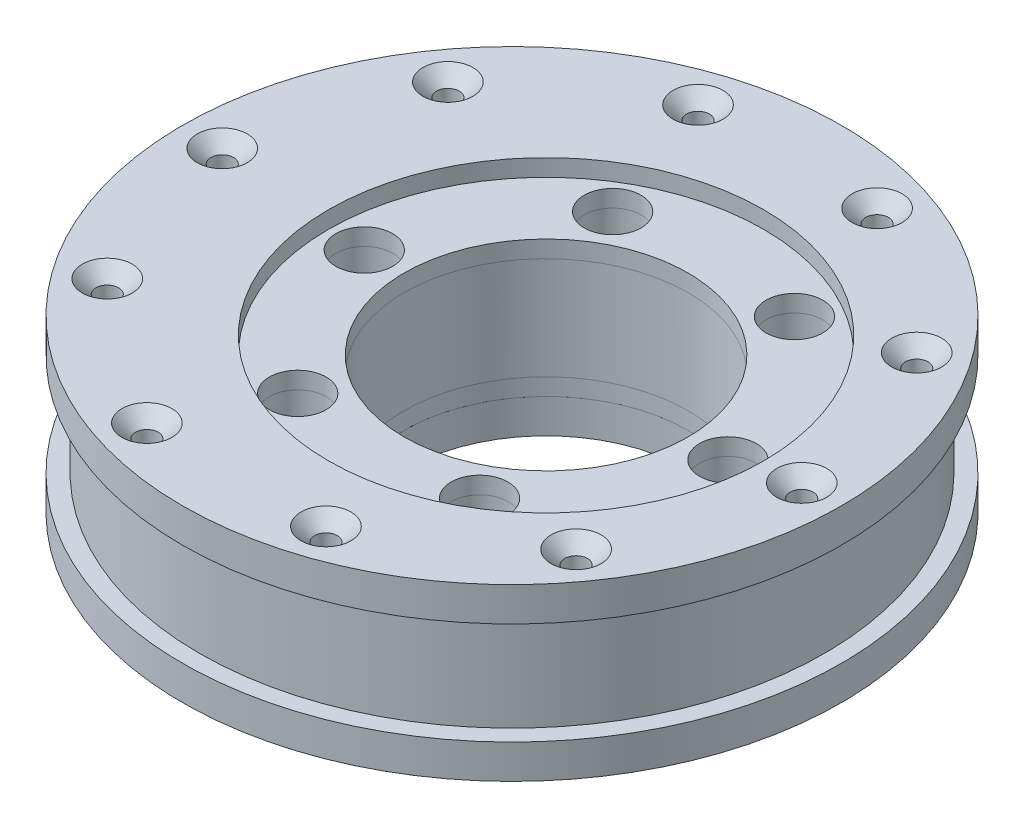
from build123d import *
from build123d.topology import SkipClean

# Parameters (mm, degrees)
SKETCH14_R              = 27.5
SKETCH14_R_2            = 1
SKETCH14_R_3            = 2
BOSS_EXTRUDE7_DEPTH     = 9
BOSS_EXTRUDE8_START     = 3
SKETCH15_R              = 29
SKETCH15_R_2            = 2
SKETCH15_R_3            = 1
BOSS_EXTRUDE8_DEPTH     = 3
SKETCH16_R              = 12.5
CUT_EXTRUDE1_DEPTH      = 16
SKETCH17_R              = 29
SKETCH17_R_2            = 2
SKETCH17_R_3            = 1
SKETCH17_R_4            = 12.5
BOSS_EXTRUDE9_DEPTH     = 3
CHAMFER1_SIZE           = 1.2
CHAMFER2_SIZE           = 1.2
SKETCH18_R              = 19.15
CUT_EXTRUDE2_DEPTH      = 1.5
SKETCH19_R              = 19.15
CUT_EXTRUDE3_DEPTH      = 1.5
SKETCH20_R              = 19.15
SKETCH20_R_2            = 12.5
SKETCH20_R_3            = 2
BOSS_EXTRUDE10_DEPTH    = 3
SKETCH21_R              = 1.75
CUT_EXTRUDE4_DEPTH      = 3
SKETCH22_R              = 1
BOSS_EXTRUDE11_DEPTH    = 3
SKETCH23_R              = 1.75
CUT_EXTRUDE5_DEPTH      = 3
CUT_EXTRUDE6_DEPTH      = 44.669211122
CUT_EXTRUDE6_DEPTH_BACK = 44.669211122
SKETCH24_R              = 2.5


# Read off the part's stored shape, not the designer's step: Intersect1, Intersect2
with BuildPart() as part:
    # Sketch14 → Boss-Extrude7 (new body)
    with BuildSketch(Plane(origin=(0, 0, 0), x_dir=(1, 0, 0), z_dir=(0, 1, 0))):
        with Locations(Location((0, 0, 0), (0, 0, 270))):
            Circle(SKETCH14_R)
        with Locations(Location((-25.5, 0, 0), (0, 0, 270))):
            Circle(SKETCH14_R_2, mode=Mode.SUBTRACT)
        with Locations(Location((-20.629933357, 14.988523933, 0), (0, 0, 270))):
            Circle(SKETCH14_R_2, mode=Mode.SUBTRACT)
        with Locations(Location((-7.879933357, 24.251941166, 0), (0, 0, 270))):
            Circle(SKETCH14_R_2, mode=Mode.SUBTRACT)
        with Locations(Location((7.879933357, 24.251941166, 0), (0, 0, 270))):
            Circle(SKETCH14_R_2, mode=Mode.SUBTRACT)
        with Locations(Location((20.629933357, 14.988523933, 0), (0, 0, 270))):
            Circle(SKETCH14_R_2, mode=Mode.SUBTRACT)
        with Locations(Location((25.5, 0, 0), (0, 0, 270))):
            Circle(SKETCH14_R_2, mode=Mode.SUBTRACT)
        with Locations(Location((20.629933357, -14.988523933, 0), (0, 0, 270))):
            Circle(SKETCH14_R_2, mode=Mode.SUBTRACT)
        with Locations(Location((7.879933357, -24.251941166, 0), (0, 0, 270))):
            Circle(SKETCH14_R_2, mode=Mode.SUBTRACT)
        with Locations(Location((-7.879933357, -24.251941166, 0), (0, 0, 270))):
            Circle(SKETCH14_R_2, mode=Mode.SUBTRACT)
        with Locations(Location((-20.629933357, -14.988523933, 0), (0, 0, 270))):
            Circle(SKETCH14_R_2, mode=Mode.SUBTRACT)
        with Locations(Location((-13, 0, 0), (0, 0, 270))):
            Circle(SKETCH14_R_3, mode=Mode.SUBTRACT)
        with Locations(Location((-5, 13.856406461, 0), (0, 0, 270))):
            Circle(SKETCH14_R_3, mode=Mode.SUBTRACT)
        with Locations(Location((11, 13.856406461, 0), (0, 0, 270))):
            Circle(SKETCH14_R_3, mode=Mode.SUBTRACT)
        with Locations(Location((19, 0, 0), (0, 0, 270))):
            Circle(SKETCH14_R_3, mode=Mode.SUBTRACT)
        with Locations(Location((11, -13.856406461, 0), (0, 0, 270))):
            Circle(SKETCH14_R_3, mode=Mode.SUBTRACT)
        with Locations(Location((-5, -13.856406461, 0), (0, 0, 270))):
            Circle(SKETCH14_R_3, mode=Mode.SUBTRACT)
    extrude(amount=BOSS_EXTRUDE7_DEPTH)

    # Sketch15 → Boss-Extrude8 (add)
    with SkipClean():  # the faces are left unmerged after this step: merging them gives an invalid solid
        with BuildSketch(Plane.XZ.offset(BOSS_EXTRUDE8_START)):
            with Locations(Location((0, 0, 0), (0, 0, 270))):
                Circle(SKETCH15_R)
            with Locations(Location((-13, 0, 0), (0, 0, 270))):
                Circle(SKETCH15_R_2, mode=Mode.SUBTRACT)
            with Locations(Location((-25.5, 0, 0), (0, 0, 270))):
                Circle(SKETCH15_R_3, mode=Mode.SUBTRACT)
            with Locations(Location((-20.629933357, 14.988523933, 0), (0, 0, 270))):
                Circle(SKETCH15_R_3, mode=Mode.SUBTRACT)
            with Locations(Location((-7.879933357, 24.251941166, 0), (0, 0, 270))):
                Circle(SKETCH15_R_3, mode=Mode.SUBTRACT)
            with Locations(Location((7.879933357, 24.251941166, 0), (0, 0, 270))):
                Circle(SKETCH15_R_3, mode=Mode.SUBTRACT)
            with Locations(Location((20.629933357, 14.988523933, 0), (0, 0, 270))):
                Circle(SKETCH15_R_3, mode=Mode.SUBTRACT)
            with Locations(Location((25.5, 0, 0), (0, 0, 270))):
                Circle(SKETCH15_R_3, mode=Mode.SUBTRACT)
            with Locations(Location((20.629933357, -14.988523933, 0), (0, 0, 270))):
                Circle(SKETCH15_R_3, mode=Mode.SUBTRACT)
            with Locations(Location((7.879933357, -24.251941166, 0), (0, 0, 270))):
                Circle(SKETCH15_R_3, mode=Mode.SUBTRACT)
            with Locations(Location((-7.879933357, -24.251941166, 0), (0, 0, 270))):
                Circle(SKETCH15_R_3, mode=Mode.SUBTRACT)
            with Locations(Location((-20.629933357, -14.988523933, 0), (0, 0, 270))):
                Circle(SKETCH15_R_3, mode=Mode.SUBTRACT)
            with Locations(Location((-5, 13.856406461, 0), (0, 0, 270))):
                Circle(SKETCH15_R_2, mode=Mode.SUBTRACT)
            with Locations(Location((11, 13.856406461, 0), (0, 0, 270))):
                Circle(SKETCH15_R_2, mode=Mode.SUBTRACT)
            with Locations(Location((19, 0, 0), (0, 0, 270))):
                Circle(SKETCH15_R_2, mode=Mode.SUBTRACT)
            with Locations(Location((11, -13.856406461, 0), (0, 0, 270))):
                Circle(SKETCH15_R_2, mode=Mode.SUBTRACT)
            with Locations(Location((-5, -13.856406461, 0), (0, 0, 270))):
                Circle(SKETCH15_R_2, mode=Mode.SUBTRACT)
        extrude(amount=-BOSS_EXTRUDE8_DEPTH)

    # Sketch16 → Cut-Extrude1 (cut)
    with SkipClean():  # the faces are left unmerged after this step: merging them gives an invalid solid
        with BuildSketch(Plane(origin=(0, 9, 0), x_dir=(1, 0, 0), z_dir=(0, 1, 0))):
            with Locations(Location((3, 0, 0), (0, 0, 270))):
                Circle(SKETCH16_R)
        extrude(amount=-CUT_EXTRUDE1_DEPTH, mode=Mode.SUBTRACT)

    # Sketch17 → Boss-Extrude9 (add)
    with BuildSketch(Plane(origin=(0, 9, 0), x_dir=(1, 0, 0), z_dir=(0, 1, 0))):
        with Locations(Location((0, 0, 0), (0, 0, 90))):
            Circle(SKETCH17_R)
        with Locations(Location((-13, 0, 0), (0, 0, 90))):
            Circle(SKETCH17_R_2, mode=Mode.SUBTRACT)
        with Locations(Location((-5, -13.856406461, 0), (0, 0, 90))):
            Circle(SKETCH17_R_2, mode=Mode.SUBTRACT)
        with Locations(Location((11, -13.856406461, 0), (0, 0, 90))):
            Circle(SKETCH17_R_2, mode=Mode.SUBTRACT)
        with Locations(Location((19, 0, 0), (0, 0, 90))):
            Circle(SKETCH17_R_2, mode=Mode.SUBTRACT)
        with Locations(Location((11, 13.856406461, 0), (0, 0, 90))):
            Circle(SKETCH17_R_2, mode=Mode.SUBTRACT)
        with Locations(Location((-5, 13.856406461, 0), (0, 0, 90))):
            Circle(SKETCH17_R_2, mode=Mode.SUBTRACT)
        with Locations(Location((-20.629933357, 14.988523933, 0), (0, 0, 90))):
            Circle(SKETCH17_R_3, mode=Mode.SUBTRACT)
        with Locations(Location((-7.879933357, 24.251941166, 0), (0, 0, 90))):
            Circle(SKETCH17_R_3, mode=Mode.SUBTRACT)
        with Locations(Location((7.879933357, 24.251941166, 0), (0, 0, 90))):
            Circle(SKETCH17_R_3, mode=Mode.SUBTRACT)
        with Locations(Location((20.629933357, 14.988523933, 0), (0, 0, 90))):
            Circle(SKETCH17_R_3, mode=Mode.SUBTRACT)
        with Locations(Location((25.5, 0, 0), (0, 0, 90))):
            Circle(SKETCH17_R_3, mode=Mode.SUBTRACT)
        with Locations(Location((20.629933357, -14.988523933, 0), (0, 0, 90))):
            Circle(SKETCH17_R_3, mode=Mode.SUBTRACT)
        with Locations(Location((7.879933357, -24.251941166, 0), (0, 0, 90))):
            Circle(SKETCH17_R_3, mode=Mode.SUBTRACT)
        with Locations(Location((-7.879933357, -24.251941166, 0), (0, 0, 90))):
            Circle(SKETCH17_R_3, mode=Mode.SUBTRACT)
        with Locations(Location((-20.629933357, -14.988523933, 0), (0, 0, 90))):
            Circle(SKETCH17_R_3, mode=Mode.SUBTRACT)
        with Locations(Location((-25.5, 0, 0), (0, 0, 90))):
            Circle(SKETCH17_R_3, mode=Mode.SUBTRACT)
        with Locations(Location((3, 0, 0), (0, 0, 270))):
            Circle(SKETCH17_R_4, mode=Mode.SUBTRACT)
    extrude(amount=BOSS_EXTRUDE9_DEPTH)


with BuildPart() as body_2:
    # Intersect1: the piece on the far side of the plane
    add(part.part)
    split(bisect_by=Plane(origin=(0, 9, 0), x_dir=(1, 0, 0), z_dir=(0, 1, 0)), keep=Keep.BOTTOM)


with BuildPart() as part_1:
    add(part.part)

    # Intersect1
    split(bisect_by=Plane(origin=(0, 9, 0), x_dir=(1, 0, 0), z_dir=(0, 1, 0)), keep=Keep.TOP)

    # Chamfer1
    chamfer1_edges = [part_1.edges().sort_by_distance(p)[0] for p in [
        (-25.5, 12, 1),
        (-20.629933357, 12, 15.988523933),
        (-7.879933357, 12, 25.251941166),
        (7.879933357, 12, 25.251941166),
        (20.629933357, 12, 15.988523933),
        (25.5, 12, 1),
        (20.629933357, 12, -13.988523933),
        (7.879933357, 12, -23.251941166),
        (-7.879933357, 12, -23.251941166),
        (-20.629933357, 12, -13.988523933),
    ]]
    chamfer(chamfer1_edges, length=CHAMFER1_SIZE)

    # Sketch19 → Cut-Extrude3 (cut)
    with BuildSketch(Plane(origin=(0, 12, 0), x_dir=(1, 0, 0), z_dir=(0, 1, 0))):
        with Locations(Location((3, 0, 0), (0, 0, 90))):
            Circle(SKETCH19_R)
    extrude(amount=-CUT_EXTRUDE3_DEPTH, mode=Mode.SUBTRACT)


with BuildPart() as body_3:
    # Intersect2: the piece on the far side of the plane
    add(body_2.part)
    split(bisect_by=Plane(origin=(0, 0, 0), x_dir=(1, 0, 0), z_dir=(0, 1, 0)), keep=Keep.BOTTOM)

    # Chamfer2
    chamfer2_2_edges = [body_3.edges().sort_by_distance(p)[0] for p in [
        (-7.879933357, -3, 25.251941166),
        (20.629933357, -3, 15.988523933),
        (20.629933357, -3, -13.988523933),
        (-7.879933357, -3, -23.251941166),
        (-25.5, -3, 1),
        (-20.629933357, -3, -13.988523933),
        (7.879933357, -3, -23.251941166),
        (25.5, -3, 1),
        (7.879933357, -3, 25.251941166),
        (-20.629933357, -3, 15.988523933),
    ]]
    chamfer(chamfer2_2_edges, length=CHAMFER2_SIZE)

    # Sketch18 → Cut-Extrude2 (cut)
    with BuildSketch(Plane.XZ.offset(3)):
        with Locations(Location((3, 0, 0), (0, 0, 270))):
            Circle(SKETCH18_R)
    extrude(amount=-CUT_EXTRUDE2_DEPTH, mode=Mode.SUBTRACT)


with BuildPart() as body_2_1:
    add(body_2.part)

    # Intersect2
    split(bisect_by=Plane(origin=(0, 0, 0), x_dir=(1, 0, 0), z_dir=(0, 1, 0)), keep=Keep.TOP)

    # Sketch21 → Cut-Extrude4 (cut)
    with BuildSketch(Plane.XZ):
        with Locations(Location((-25.5, 0, 0), (0, 0, 270))):
            Circle(SKETCH21_R)
        with Locations(Location((-20.629933357, 14.988523933, 0), (0, 0, 270))):
            Circle(SKETCH21_R)
        with Locations(Location((-7.879933357, 24.251941166, 0), (0, 0, 270))):
            Circle(SKETCH21_R)
        with Locations(Location((7.879933357, 24.251941166, 0), (0, 0, 270))):
            Circle(SKETCH21_R)
        with Locations(Location((20.629933357, 14.988523933, 0), (0, 0, 270))):
            Circle(SKETCH21_R)
        with Locations(Location((25.5, 0, 0), (0, 0, 270))):
            Circle(SKETCH21_R)
        with Locations(Location((20.629933357, -14.988523933, 0), (0, 0, 270))):
            Circle(SKETCH21_R)
        with Locations(Location((7.879933357, -24.251941166, 0), (0, 0, 270))):
            Circle(SKETCH21_R)
        with Locations(Location((-7.879933357, -24.251941166, 0), (0, 0, 270))):
            Circle(SKETCH21_R)
        with Locations(Location((-20.629933357, -14.988523933, 0), (0, 0, 270))):
            Circle(SKETCH21_R)
    extrude(amount=-CUT_EXTRUDE4_DEPTH, mode=Mode.SUBTRACT)

    # Sketch22 → Boss-Extrude11 (add)
    with BuildSketch(Plane.XZ.offset(-3)):
        with Locations(Location((-25.5, 0, 0), (0, 0, 270))):
            Circle(SKETCH22_R)
        with Locations(Location((-20.629933357, 14.988523933, 0), (0, 0, 270))):
            Circle(SKETCH22_R)
        with Locations(Location((-7.879933357, 24.251941166, 0), (0, 0, 270))):
            Circle(SKETCH22_R)
        with Locations(Location((7.879933357, 24.251941166, 0), (0, 0, 270))):
            Circle(SKETCH22_R)
        with Locations(Location((20.629933357, 14.988523933, 0), (0, 0, 270))):
            Circle(SKETCH22_R)
        with Locations(Location((25.5, 0, 0), (0, 0, 270))):
            Circle(SKETCH22_R)
        with Locations(Location((20.629933357, -14.988523933, 0), (0, 0, 270))):
            Circle(SKETCH22_R)
        with Locations(Location((7.879933357, -24.251941166, 0), (0, 0, 270))):
            Circle(SKETCH22_R)
        with Locations(Location((-7.879933357, -24.251941166, 0), (0, 0, 270))):
            Circle(SKETCH22_R)
        with Locations(Location((-20.629933357, -14.988523933, 0), (0, 0, 270))):
            Circle(SKETCH22_R)
    extrude(amount=-BOSS_EXTRUDE11_DEPTH)

    # Sketch23 → Cut-Extrude5 (cut)
    with BuildSketch(Plane(origin=(0, 9, 0), x_dir=(1, 0, 0), z_dir=(0, 1, 0))):
        with Locations(Location((-25.5, 0, 0), (0, 0, 90))):
            Circle(SKETCH23_R)
        with Locations(Location((-20.629933357, 14.988523933, 0), (0, 0, 90))):
            Circle(SKETCH23_R)
        with Locations(Location((-7.879933357, 24.251941166, 0), (0, 0, 90))):
            Circle(SKETCH23_R)
        with Locations(Location((7.879933357, 24.251941166, 0), (0, 0, 90))):
            Circle(SKETCH23_R)
        with Locations(Location((20.629933357, 14.988523933, 0), (0, 0, 90))):
            Circle(SKETCH23_R)
        with Locations(Location((25.5, 0, 0), (0, 0, 90))):
            Circle(SKETCH23_R)
        with Locations(Location((20.629933357, -14.988523933, 0), (0, 0, 90))):
            Circle(SKETCH23_R)
        with Locations(Location((7.879933357, -24.251941166, 0), (0, 0, 90))):
            Circle(SKETCH23_R)
        with Locations(Location((-7.879933357, -24.251941166, 0), (0, 0, 90))):
            Circle(SKETCH23_R)
        with Locations(Location((-20.629933357, -14.988523933, 0), (0, 0, 90))):
            Circle(SKETCH23_R)
    extrude(amount=-CUT_EXTRUDE5_DEPTH, mode=Mode.SUBTRACT)


with BuildPart() as body_4:
    # Sketch20 → Boss-Extrude10 (new body)
    with BuildSketch(Plane.XZ.offset(1.5)):
        with Locations(Location((3, 0, 0), (0, 0, 270))):
            Circle(SKETCH20_R)
        with Locations(Location((3, 0, 0), (0, 0, 270))):
            Circle(SKETCH20_R_2, mode=Mode.SUBTRACT)
        with Locations(Location((19, 0, 0), (0, 0, 270))):
            Circle(SKETCH20_R_3, mode=Mode.SUBTRACT)
        with Locations(Location((11, -13.856406461, 0), (0, 0, 270))):
            Circle(SKETCH20_R_3, mode=Mode.SUBTRACT)
        with Locations(Location((-5, -13.856406461, 0), (0, 0, 270))):
            Circle(SKETCH20_R_3, mode=Mode.SUBTRACT)
        with Locations(Location((-13, 0, 0), (0, 0, 270))):
            Circle(SKETCH20_R_3, mode=Mode.SUBTRACT)
        with Locations(Location((-5, 13.856406461, 0), (0, 0, 270))):
            Circle(SKETCH20_R_3, mode=Mode.SUBTRACT)
        with Locations(Location((11, 13.856406461, 0), (0, 0, 270))):
            Circle(SKETCH20_R_3, mode=Mode.SUBTRACT)
    extrude(amount=BOSS_EXTRUDE10_DEPTH)


with BuildPart() as cut_extrude6_tool:
    # Sketch24 → Cut-Extrude6 (new, two sides: drawn at the far end of the back side and taken through both)
    with BuildSketch(Plane(origin=(0, 10.5, 0), x_dir=(1, 0, 0), z_dir=(0, 1, 0)).offset(-CUT_EXTRUDE6_DEPTH_BACK)):
        with Locations(Location((-13, 0, 0), (0, 0, 270))):
            Circle(SKETCH24_R)
        with Locations(Location((-5, 13.856406461, 0), (0, 0, 270))):
            Circle(SKETCH24_R)
        with Locations(Location((11, 13.856406461, 0), (0, 0, 270))):
            Circle(SKETCH24_R)
        with Locations(Location((19, 0, 0), (0, 0, 270))):
            Circle(SKETCH24_R)
        with Locations(Location((11, -13.856406461, 0), (0, 0, 270))):
            Circle(SKETCH24_R)
        with Locations(Location((-5, -13.856406461, 0), (0, 0, 270))):
            Circle(SKETCH24_R)
    extrude(amount=CUT_EXTRUDE6_DEPTH + CUT_EXTRUDE6_DEPTH_BACK)


with BuildPart() as part_2:
    add(part_1.part)

    # Cut-Extrude6: cut by cut_extrude6_tool
    add(cut_extrude6_tool.part, mode=Mode.SUBTRACT)


with BuildPart() as body_2_2:
    add(body_2_1.part)

    # Cut-Extrude6: cut by cut_extrude6_tool
    add(cut_extrude6_tool.part, mode=Mode.SUBTRACT)


with BuildPart() as body_3_1:
    add(body_3.part)

    # Cut-Extrude6: cut by cut_extrude6_tool
    add(cut_extrude6_tool.part, mode=Mode.SUBTRACT)


with BuildPart() as body_4_1:
    add(body_4.part)

    # Cut-Extrude6: cut by cut_extrude6_tool
    add(cut_extrude6_tool.part, mode=Mode.SUBTRACT)


solid = Compound([part_2.part, body_2_2.part, body_3_1.part, body_4_1.part])
